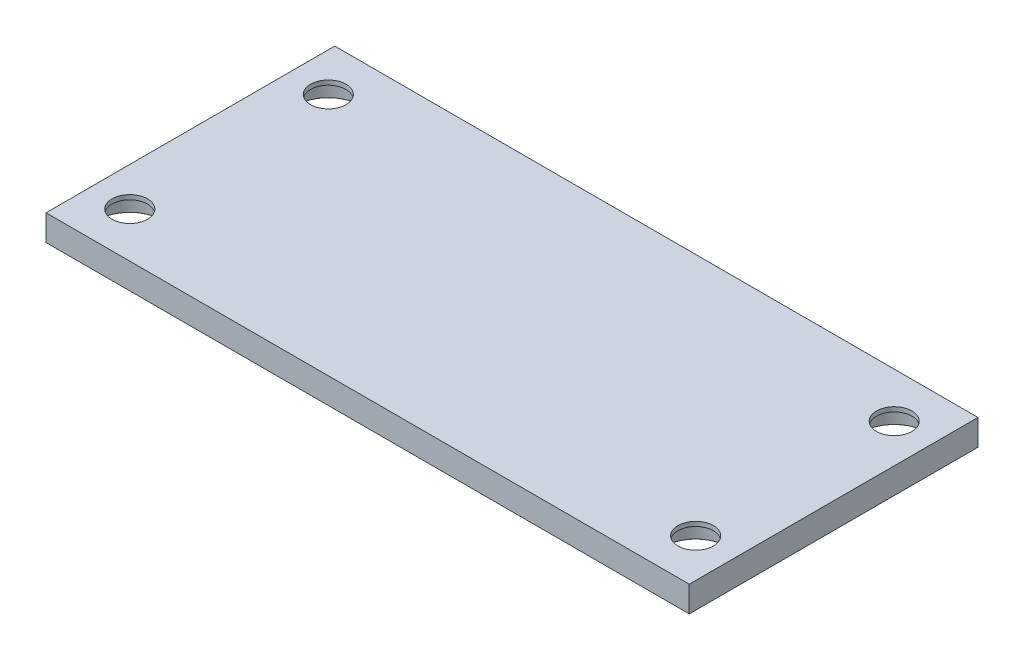
from build123d import *

# Parameters (mm, degrees)
SKETCH_1_W      = 99.8
SKETCH_1_H      = 44.8
EXTRUDE_1_DEPTH = 4


# Read off the part's stored shape, not the designer's step: M5 扁圆形螺钉的柱孔
with BuildPart() as part:
    # 草图1 → 凸台-拉伸1 (new body)
    with BuildSketch(Plane(origin=(0, 0, 0), x_dir=(1, 0, 0), z_dir=(0, 1, 0))):
        Rectangle(SKETCH_1_W, SKETCH_1_H)
    extrude(amount=EXTRUDE_1_DEPTH)

    # M5 扁圆形螺钉的柱孔 outline → M5 扁圆形螺钉的柱孔 (revolve, cut)
    with BuildSketch(Plane(origin=(43.9, 0, -15.4), x_dir=(1, 0, 0), z_dir=(0, 0, 1))):
        Polygon((2.75, 3.3), (2.75, 4), (0, 4), (0, 0), (5.025, 0), (5, 0.025), (5, 3.3), align=None)
    revolve(axis=Axis((43.9, 0, -15.4), (0, 1, 0)), mode=Mode.SUBTRACT)

    # Hole Wizard M5 2 outline → Hole Wizard M5 2 (revolve, cut)
    with BuildSketch(Plane(origin=(43.9, 0, 15.4), x_dir=(1, 0, 0), z_dir=(0, 0, 1))):
        Polygon((0, 0), (5.025, 0), (5, 0.025), (5, 3.3), (2.75, 3.3), (2.75, 4), (0, 4), align=None)
    revolve(axis=Axis((43.9, 0, 15.4), (0, 1, 0)), mode=Mode.SUBTRACT)

    # Hole Wizard M5 3 outline → Hole Wizard M5 3 (revolve, cut)
    with BuildSketch(Plane(origin=(-43.9, 0, 15.4), x_dir=(1, 0, 0), z_dir=(0, 0, 1))):
        Polygon((0, 0), (5.025, 0), (5, 0.025), (5, 3.3), (2.75, 3.3), (2.75, 4), (0, 4), align=None)
    revolve(axis=Axis((-43.9, 0, 15.4), (0, 1, 0)), mode=Mode.SUBTRACT)

    # Hole Wizard M5 4 outline → Hole Wizard M5 4 (revolve, cut)
    with BuildSketch(Plane(origin=(-43.9, 0, -15.4), x_dir=(1, 0, 0), z_dir=(0, 0, 1))):
        Polygon((0, 0), (5.025, 0), (5, 0.025), (5, 3.3), (2.75, 3.3), (2.75, 4), (0, 4), align=None)
    revolve(axis=Axis((-43.9, 0, -15.4), (0, 1, 0)), mode=Mode.SUBTRACT)


solid = part.part
